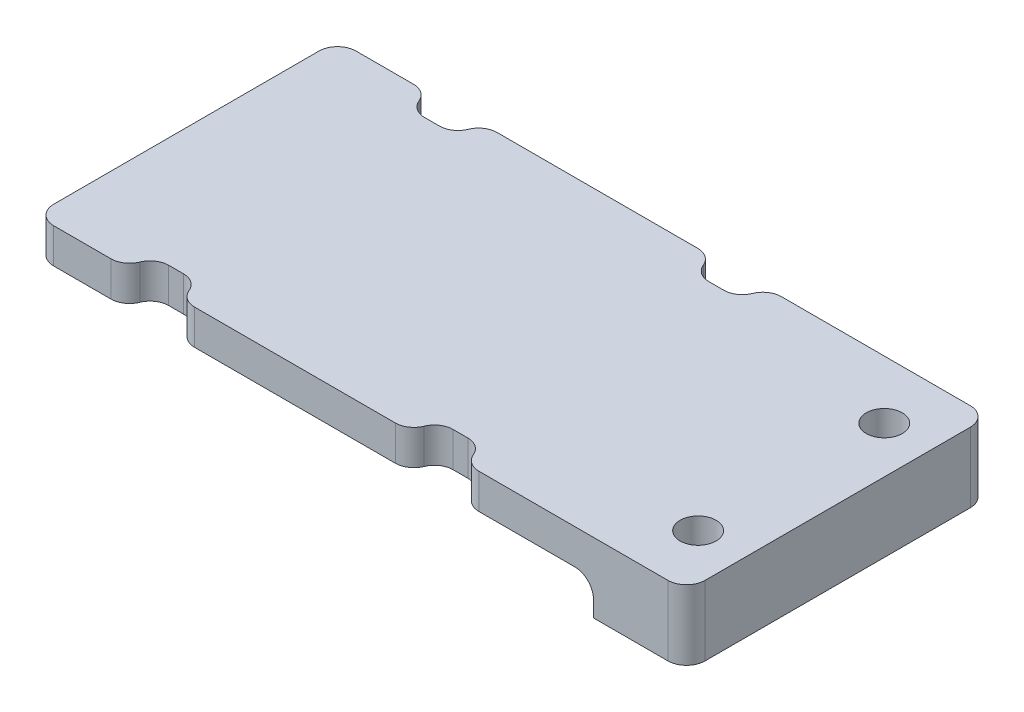
from build123d import *

# Parameters (mm, degrees)
SKETCH1_W                    = 88.9
SKETCH1_H                    = 41.275
BOSS_EXTRUDE1_DEPTH          = 4.7625
SKETCH3_W                    = 12.7
SKETCH3_H                    = 41.275
BOSS_EXTRUDE2_DEPTH          = 4.7625
F_10_0_1935_DIAMETER_HOLE1_D = 4.9149
SKETCH9_W                    = 6.35
SKETCH9_H                    = 3.175
CUT_EXTRUDE1_DEPTH           = 50.924287989
FILLET1_R                    = 2.54
FILLET2_R                    = 2.54


with BuildPart() as part:
    # Sketch1 → Boss-Extrude1 (new body)
    with BuildSketch(Plane(origin=(0, 0, 0), x_dir=(1, 0, 0), z_dir=(0, 1, 0))):
        Rectangle(SKETCH1_W, SKETCH1_H)
    extrude(amount=BOSS_EXTRUDE1_DEPTH)

    # Sketch3 → Boss-Extrude2 (add)
    with BuildSketch(Plane.XZ):
        with Locations((38.1, 0)):
            Rectangle(SKETCH3_W, SKETCH3_H)
    extrude(amount=BOSS_EXTRUDE2_DEPTH)

    # #10 (0.1935) Diameter Hole1 (through all)
    with Locations(Plane(origin=(0, 4.7625, 0), x_dir=(1, 0, 0), z_dir=(0, 1, 0))):
        with Locations((38.1, 12.7), (38.1, -12.7)):
            Hole(F_10_0_1935_DIAMETER_HOLE1_D / 2)

    # Sketch9 → Cut-Extrude1 (cut, through all)
    with BuildSketch(Plane(origin=(0, 4.7625, 0), x_dir=(1, 0, 0), z_dir=(0, 1, 0))):
        with Locations((10.422957564, 19.05)):
            Rectangle(SKETCH9_W, SKETCH9_H)
        with Locations((-28.3765625, 19.05)):
            Rectangle(SKETCH9_W, SKETCH9_H)
        with Locations((-28.3765625, -19.05)):
            Rectangle(SKETCH9_W, SKETCH9_H)
        with Locations((10.422957564, -19.05)):
            Rectangle(SKETCH9_W, SKETCH9_H)
    extrude(amount=-CUT_EXTRUDE1_DEPTH, mode=Mode.SUBTRACT)

    # Fillet1
    fillet1_edges = [part.edges().sort_by_distance(p)[0] for p in [
        (-25.2015625, 2.38125, 20.6375),
        (-31.5515625, 2.38125, 20.6375),
        (-44.45, 2.38125, 20.6375),
        (-31.5515625, 2.38125, -20.6375),
        (-25.2015625, 2.38125, -20.6375),
        (7.247957564, 2.38125, -20.6375),
        (13.597957564, 2.38125, -20.6375),
        (44.45, 0, -20.6375),
        (44.45, 0, 20.6375),
        (13.597957564, 2.38125, 20.6375),
        (7.247957564, 2.38125, 20.6375),
        (-44.45, 2.38125, -20.6375),
    ]]
    fillet(fillet1_edges, radius=FILLET1_R)

    # Fillet2
    fillet2_edges = [part.edges().sort_by_distance(p)[0] for p in [
        (-31.5515625, 2.38125, -17.4625),
        (-25.2015625, 2.38125, -17.4625),
        (13.597957564, 2.38125, -17.4625),
        (7.247957564, 2.38125, -17.4625),
        (31.75, 0, 0),
        (13.597957564, 2.38125, 17.4625),
        (7.247957564, 2.38125, 17.4625),
        (-31.5515625, 2.38125, 17.4625),
        (-25.2015625, 2.38125, 17.4625),
    ]]
    fillet(fillet2_edges, radius=FILLET2_R)


solid = part.part
